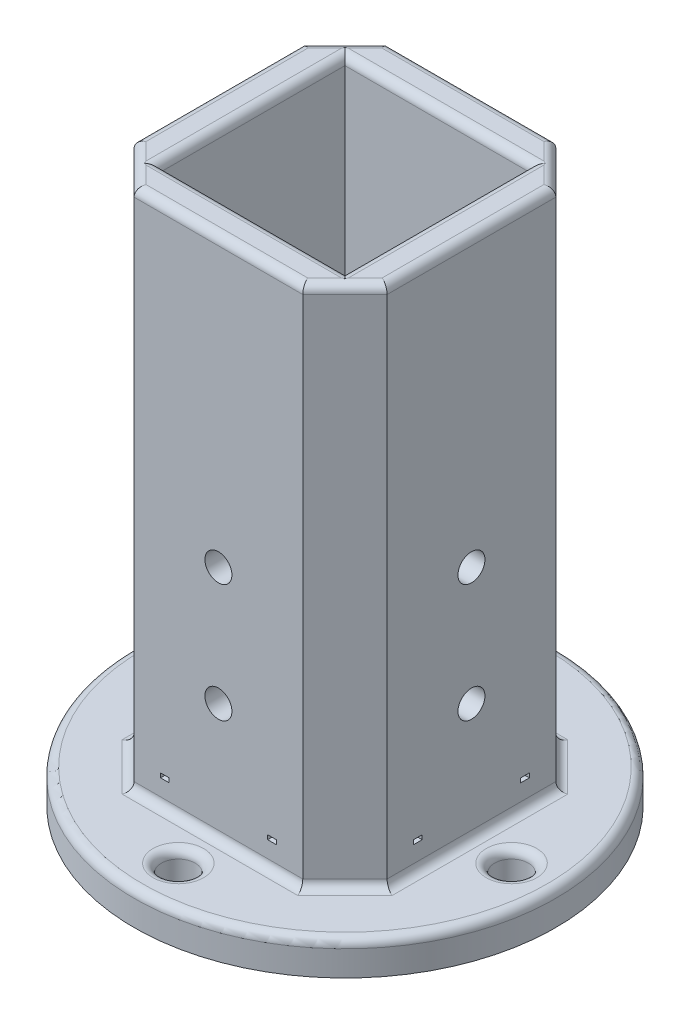
from build123d import *

# Parameters (mm, degrees)
SKETCH1_W           = 30
SKETCH1_H           = 30
BOSS_EXTRUDE1_DEPTH = 62
SHELL1_T            = -4
SKETCH2_R           = 1.6
CUT_EXTRUDE1_DEPTH  = 62
SKETCH3_R           = 25
SKETCH3_R_2         = 2
SKETCH3_W           = 22
SKETCH3_H           = 22
BOSS_EXTRUDE2_DEPTH = 4
CIRPATTERN1_COUNT   = 2
CIRPATTERN1_ANGLE   = 90
CHAMFER1_SIZE       = 5
FILLET1_R           = 1
FILLET2_R           = 1
SKETCH4_W           = 1.02
SKETCH4_H           = 0.51
CUT_EXTRUDE2_DEPTH  = 83.097503007
CIRPATTERN2_COUNT   = 2
CIRPATTERN2_ANGLE   = 90


with BuildPart() as part:
    # Sketch1 → Boss-Extrude1 (new body)
    with BuildSketch(Plane(origin=(0, 0, 0), x_dir=(1, 0, 0), z_dir=(0, 1, 0))):
        with Locations((15, 15)):
            Rectangle(SKETCH1_W, SKETCH1_H)
    extrude(amount=BOSS_EXTRUDE1_DEPTH)

    # Shell1
    shell1_openings = [part.faces().sort_by_distance(p)[0] for p in [
        (15, 62, -15),
        (15, 0, -15),
    ]]
    offset(amount=SHELL1_T, openings=shell1_openings, kind=Kind.INTERSECTION)

    # Sketch2 → Cut-Extrude1 (cut)
    with BuildSketch(Plane(origin=(30, 0, 0), x_dir=(0, 0, -1), z_dir=(1, 0, 0))):
        with Locations((15, 14)):
            Circle(SKETCH2_R)
        with Locations((15, 28)):
            Circle(SKETCH2_R)
    cut_extrude1 = extrude(amount=-CUT_EXTRUDE1_DEPTH, mode=Mode.SUBTRACT)

    # Sketch3 → Boss-Extrude2 (add)
    with BuildSketch(Plane.XZ):
        with Locations(Location((15, -15, 0), (0, 0, 270))):
            Circle(SKETCH3_R)
        with Locations(Location((34.75, -15, 0), (0, 0, 270))):
            Circle(SKETCH3_R_2, mode=Mode.SUBTRACT)
        with Locations(Location((15, -34.75, 0), (0, 0, 270))):
            Circle(SKETCH3_R_2, mode=Mode.SUBTRACT)
        with Locations(Location((-4.75, -15, 0), (0, 0, 270))):
            Circle(SKETCH3_R_2, mode=Mode.SUBTRACT)
        with Locations(Location((15, 4.75, 0), (0, 0, 270))):
            Circle(SKETCH3_R_2, mode=Mode.SUBTRACT)
        with Locations((15, -15)):
            Rectangle(SKETCH3_W, SKETCH3_H, mode=Mode.SUBTRACT)
    extrude(amount=BOSS_EXTRUDE2_DEPTH)

    # CirPattern1: Cut-Extrude1 ×2 about axis
    cirpattern1_axis = Axis((15, -4, -15), (0, 1, 0))
    for i in range(1, CIRPATTERN1_COUNT):
        add(cut_extrude1.rotate(cirpattern1_axis, i * CIRPATTERN1_ANGLE / (CIRPATTERN1_COUNT - 1)), mode=Mode.SUBTRACT)

    # Chamfer1
    chamfer1_edges = [part.edges().sort_by_distance(p)[0] for p in [
        (0, 31, -30),
        (30, 31, -30),
        (30, 31, 0),
        (0, 31, 0),
    ]]
    chamfer(chamfer1_edges, length=CHAMFER1_SIZE)

    # Fillet1
    # the kernel refuses this fillet: 1 mm, written as the material it takes off along each edge
    with BuildSketch(Plane(origin=(4, 62, -4), x_dir=(-1, 0, 0), z_dir=(0, 0, -1)), Plane(origin=(26, 62, -4), x_dir=(0, 0, 1), z_dir=(-1, 0, 0)), Plane(origin=(26, 62, -26), x_dir=(1, 0, 0), z_dir=(0, 0, 1)), Plane(origin=(4, 62, -26), x_dir=(0, 0, -1), z_dir=(1, 0, 0))) as fillet1_piece_1:
        with BuildLine():
            CenterArc((FILLET1_R, -FILLET1_R), FILLET1_R, 90, 90)
            Line((0, -FILLET1_R), (0, 0))
            Line((0, 0), (FILLET1_R, 0))
        make_face()
    extrude(amount=22, mode=Mode.SUBTRACT)
    with BuildSketch(Plane(origin=(2.5, 62, 0), x_dir=(0, -1, 0), z_dir=(1, 0, 0))) as fillet1_piece_2:
        with BuildLine():
            CenterArc((FILLET1_R, FILLET1_R), FILLET1_R, 180, 90)
            Line((0, FILLET1_R), (0, 0))
            Line((0, 0), (FILLET1_R, 0))
        make_face()
    extrude(amount=25, mode=Mode.SUBTRACT)
    with BuildSketch(Plane(origin=(0, 62, -27.5), x_dir=(1, 0, 0), z_dir=(0, 0, 1)), Plane(origin=(30, 62, -2.5), x_dir=(-1, 0, 0), z_dir=(0, 0, -1)), Plane(origin=(27.5, 62, -30), x_dir=(0, 0, 1), z_dir=(-1, 0, 0))) as fillet1_piece_3:
        with BuildLine():
            CenterArc((FILLET1_R, -FILLET1_R), FILLET1_R, 90, 90)
            Line((0, -FILLET1_R), (0, 0))
            Line((0, 0), (FILLET1_R, 0))
        make_face()
    extrude(amount=25, mode=Mode.SUBTRACT)
    with BuildSketch(Plane(origin=(-1.767766953, 62, -23.232233047), x_dir=(0.7071067811865476, 0, 0.7071067811865476), z_dir=(0.7071067811865476, 0, -0.7071067811865476)), Plane(origin=(23.232233047, 62, 1.767766953), x_dir=(0, -1, 0), z_dir=(0.7071067811865476, 0, -0.7071067811865476))) as fillet1_piece_4:
        with BuildLine():
            CenterArc((FILLET1_R, FILLET1_R), FILLET1_R, 180, 90)
            Line((0, FILLET1_R), (0, 0))
            Line((0, 0), (FILLET1_R, 0))
        make_face()
    extrude(amount=12.071067812, mode=Mode.SUBTRACT)
    with BuildSketch(Plane(origin=(31.767766953, 62, -23.232233047), x_dir=(-0.7071067811865476, 0, 0.7071067811865476), z_dir=(-0.7071067811865476, 0, -0.7071067811865476)), Plane(origin=(6.767766953, 62, 1.767766953), x_dir=(0, -1, 0), z_dir=(-0.7071067811865476, 0, -0.7071067811865476))) as fillet1_piece_5:
        with BuildLine():
            CenterArc((FILLET1_R, -FILLET1_R), FILLET1_R, 90, 90)
            Line((0, -FILLET1_R), (0, 0))
            Line((0, 0), (FILLET1_R, 0))
        make_face()
    extrude(amount=12.071067812, mode=Mode.SUBTRACT)
    with BuildSketch(Plane(origin=(26, 62, -4), x_dir=(0, 0, 1), z_dir=(-1, 0, 0))) as fillet1_piece_6a_section:
        with BuildLine():
            CenterArc((FILLET1_R, -FILLET1_R), FILLET1_R, 90, 90)
            Line((0, -FILLET1_R), (0, 0))
            Line((0, 0), (FILLET1_R, 0))
        make_face()
    fillet1_piece_6a = extrude(amount=24.5, mode=Mode.PRIVATE)
    fillet1_piece_6a = split(fillet1_piece_6a, bisect_by=Plane(origin=(4, 61.773604886, -3.773604886), z_dir=(-1, 0, 0)), keep=Keep.TOP, mode=Mode.PRIVATE)
    with BuildSketch(Plane(origin=(4, 62, -1.5), x_dir=(-1, 0, 0), z_dir=(0, 0, -1))) as fillet1_piece_6b_section:
        with BuildLine():
            CenterArc((FILLET1_R, -FILLET1_R), FILLET1_R, 90, 90)
            Line((0, -FILLET1_R), (0, 0))
            Line((0, 0), (FILLET1_R, 0))
        make_face()
    fillet1_piece_6b = extrude(amount=24.5, mode=Mode.PRIVATE)
    fillet1_piece_6b = split(fillet1_piece_6b, bisect_by=Plane(origin=(3.773604886, 61.773604886, -4), z_dir=(0, 0, 1)), keep=Keep.TOP, mode=Mode.PRIVATE)
    fillet1_piece_6 = fillet1_piece_6a & fillet1_piece_6b
    add(fillet1_piece_6, mode=Mode.SUBTRACT)
    with BuildSketch(Plane(origin=(4, 62, -4), x_dir=(-1, 0, 0), z_dir=(0, 0, -1))) as fillet1_piece_7a_section:
        with BuildLine():
            CenterArc((FILLET1_R, -FILLET1_R), FILLET1_R, 90, 90)
            Line((0, -FILLET1_R), (0, 0))
            Line((0, 0), (FILLET1_R, 0))
        make_face()
    fillet1_piece_7a = extrude(amount=24.5, mode=Mode.PRIVATE)
    fillet1_piece_7a = split(fillet1_piece_7a, bisect_by=Plane(origin=(3.773604886, 61.773604886, -26), z_dir=(0, 0, -1)), keep=Keep.TOP, mode=Mode.PRIVATE)
    with BuildSketch(Plane(origin=(1.5, 62, -26), x_dir=(0, 0, -1), z_dir=(1, 0, 0))) as fillet1_piece_7b_section:
        with BuildLine():
            CenterArc((FILLET1_R, -FILLET1_R), FILLET1_R, 90, 90)
            Line((0, -FILLET1_R), (0, 0))
            Line((0, 0), (FILLET1_R, 0))
        make_face()
    fillet1_piece_7b = extrude(amount=24.5, mode=Mode.PRIVATE)
    fillet1_piece_7b = split(fillet1_piece_7b, bisect_by=Plane(origin=(4, 61.773604886, -26.226395114), z_dir=(-1, 0, 0)), keep=Keep.TOP, mode=Mode.PRIVATE)
    fillet1_piece_7 = fillet1_piece_7a & fillet1_piece_7b
    add(fillet1_piece_7, mode=Mode.SUBTRACT)
    with BuildSketch(Plane(origin=(28.5, 62, -4), x_dir=(0, 0, 1), z_dir=(-1, 0, 0))) as fillet1_piece_8a_section:
        with BuildLine():
            CenterArc((FILLET1_R, -FILLET1_R), FILLET1_R, 90, 90)
            Line((0, -FILLET1_R), (0, 0))
            Line((0, 0), (FILLET1_R, 0))
        make_face()
    fillet1_piece_8a = extrude(amount=24.5, mode=Mode.PRIVATE)
    fillet1_piece_8a = split(fillet1_piece_8a, bisect_by=Plane(origin=(26, 61.773604886, -3.773604886), z_dir=(1, 0, 0)), keep=Keep.TOP, mode=Mode.PRIVATE)
    with BuildSketch(Plane(origin=(26, 62, -26), x_dir=(1, 0, 0), z_dir=(0, 0, 1))) as fillet1_piece_8b_section:
        with BuildLine():
            CenterArc((FILLET1_R, -FILLET1_R), FILLET1_R, 90, 90)
            Line((0, -FILLET1_R), (0, 0))
            Line((0, 0), (FILLET1_R, 0))
        make_face()
    fillet1_piece_8b = extrude(amount=24.5, mode=Mode.PRIVATE)
    fillet1_piece_8b = split(fillet1_piece_8b, bisect_by=Plane(origin=(26.226395114, 61.773604886, -4), z_dir=(0, 0, 1)), keep=Keep.TOP, mode=Mode.PRIVATE)
    fillet1_piece_8 = fillet1_piece_8a & fillet1_piece_8b
    add(fillet1_piece_8, mode=Mode.SUBTRACT)
    with BuildSketch(Plane(origin=(4, 62, -26), x_dir=(0, 0, -1), z_dir=(1, 0, 0))) as fillet1_piece_9a_section:
        with BuildLine():
            CenterArc((FILLET1_R, -FILLET1_R), FILLET1_R, 90, 90)
            Line((0, -FILLET1_R), (0, 0))
            Line((0, 0), (FILLET1_R, 0))
        make_face()
    fillet1_piece_9a = extrude(amount=24.5, mode=Mode.PRIVATE)
    fillet1_piece_9a = split(fillet1_piece_9a, bisect_by=Plane(origin=(26, 61.773604886, -26.226395114), z_dir=(1, 0, 0)), keep=Keep.TOP, mode=Mode.PRIVATE)
    with BuildSketch(Plane(origin=(26, 62, -28.5), x_dir=(1, 0, 0), z_dir=(0, 0, 1))) as fillet1_piece_9b_section:
        with BuildLine():
            CenterArc((FILLET1_R, -FILLET1_R), FILLET1_R, 90, 90)
            Line((0, -FILLET1_R), (0, 0))
            Line((0, 0), (FILLET1_R, 0))
        make_face()
    fillet1_piece_9b = extrude(amount=24.5, mode=Mode.PRIVATE)
    fillet1_piece_9b = split(fillet1_piece_9b, bisect_by=Plane(origin=(26.226395114, 61.773604886, -26), z_dir=(0, 0, -1)), keep=Keep.TOP, mode=Mode.PRIVATE)
    fillet1_piece_9 = fillet1_piece_9a & fillet1_piece_9b
    add(fillet1_piece_9, mode=Mode.SUBTRACT)

    # Fillet2
    fillet2_edges = [part.edges().sort_by_distance(p)[0] for p in [
        (34.75, 0, -13),
        (15, 0, -32.75),
        (-4.75, 0, -13),
        (15, 0, 6.75),
        (15, 0, 10),
        (15, 0, 0),
        (0, 0, -15),
        (30, 0, -15),
        (15, 0, -30),
        (2.5, 0, -2.5),
        (27.5, 0, -2.5),
        (27.5, 0, -27.5),
        (2.5, 0, -27.5),
    ]]
    fillet(fillet2_edges, radius=FILLET2_R)

    # Sketch4 → Cut-Extrude2 (cut, symmetric)
    with BuildSketch(Plane(origin=(4, 0, 0), x_dir=(0, 0, -1), z_dir=(1, 0, 0))):
        with Locations((8.65, 3.205)):
            Rectangle(SKETCH4_W, SKETCH4_H)
        with Locations((21.35, 3.205)):
            Rectangle(SKETCH4_W, SKETCH4_H)
    cut_extrude2 = extrude(amount=CUT_EXTRUDE2_DEPTH, both=True, mode=Mode.SUBTRACT)

    # CirPattern2: Cut-Extrude2 ×2 about axis
    cirpattern2_axis = Axis((15, -4, -15), (0, -1, 0))
    for i in range(1, CIRPATTERN2_COUNT):
        add(cut_extrude2.rotate(cirpattern2_axis, i * CIRPATTERN2_ANGLE / (CIRPATTERN2_COUNT - 1)), mode=Mode.SUBTRACT)


solid = part.part
